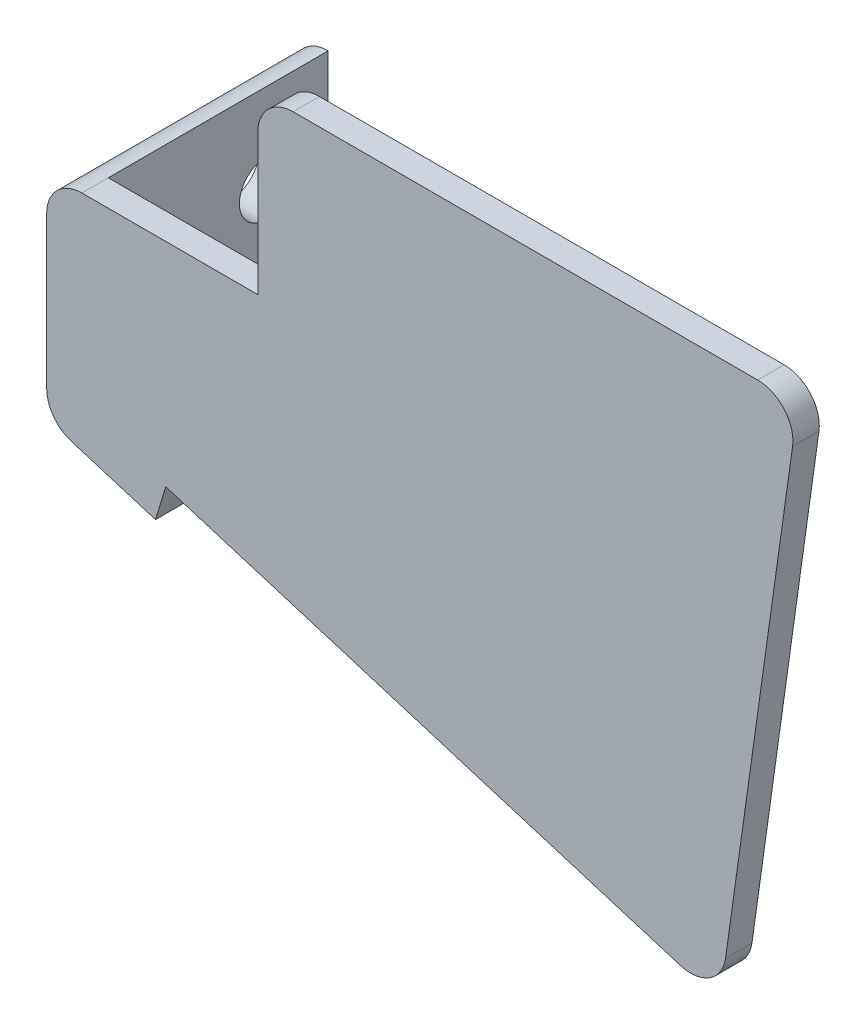
from build123d import *

# Parameters (mm, degrees)
BOSS_EXTRUDE1_DEPTH = 1.5
BOSS_EXTRUDE3_DEPTH = 14
SKETCH6_R           = 1.55
CUT_EXTRUDE1_DEPTH  = 14
FILLET1_R           = 2


with BuildPart() as part:
    # Sketch1 → Boss-Extrude1 (new body)
    with BuildSketch(Plane.XY):
        Polygon((-6.151738777, -2.72550419), (24.554874692, -2.72550419), (20.100451461, -34.420372379), (-18.151738777, -22.72550419), (-18.151738777, -12.72550419), (-6.151738777, -12.72550419), align=None)
    extrude(amount=BOSS_EXTRUDE1_DEPTH)

    # Sketch5 → Boss-Extrude3 (add)
    with BuildSketch(Plane.XY.offset(1.5)):
        Polygon((-16.151738777, -23.336965553), (-11.383691284, -24.794703962), (-11.968434693, -26.707313474), (-18.151738777, -24.816887703), (-18.151738777, -12.72550419), (-16.151738777, -12.72550419), align=None)
    extrude(amount=-BOSS_EXTRUDE3_DEPTH)

    # Sketch6 → Cut-Extrude1 (cut)
    with BuildSketch(Plane(origin=(-16.151738777, 0, 0), x_dir=(0, 0, -1), z_dir=(1, 0, 0))):
        with Locations((9, -17.72550419)):
            Circle(SKETCH6_R)
    extrude(amount=-CUT_EXTRUDE1_DEPTH, mode=Mode.SUBTRACT)

    # Fillet1
    fillet1_edges = [part.edges().sort_by_distance(p)[0] for p in [
        (-18.151738777, -12.72550419, -5.5),
        (-11.383691284, -24.794703962, -6.25),
        (-18.151738777, -24.816887703, -5.5),
        (20.100451461, -34.420372379, 0.75),
        (-6.151738777, -2.72550419, 0.75),
        (24.554874692, -2.72550419, 0.75),
    ]]
    fillet(fillet1_edges, radius=FILLET1_R - 0.0001)  # a hair under: the kernel refuses the full size


solid = part.part
